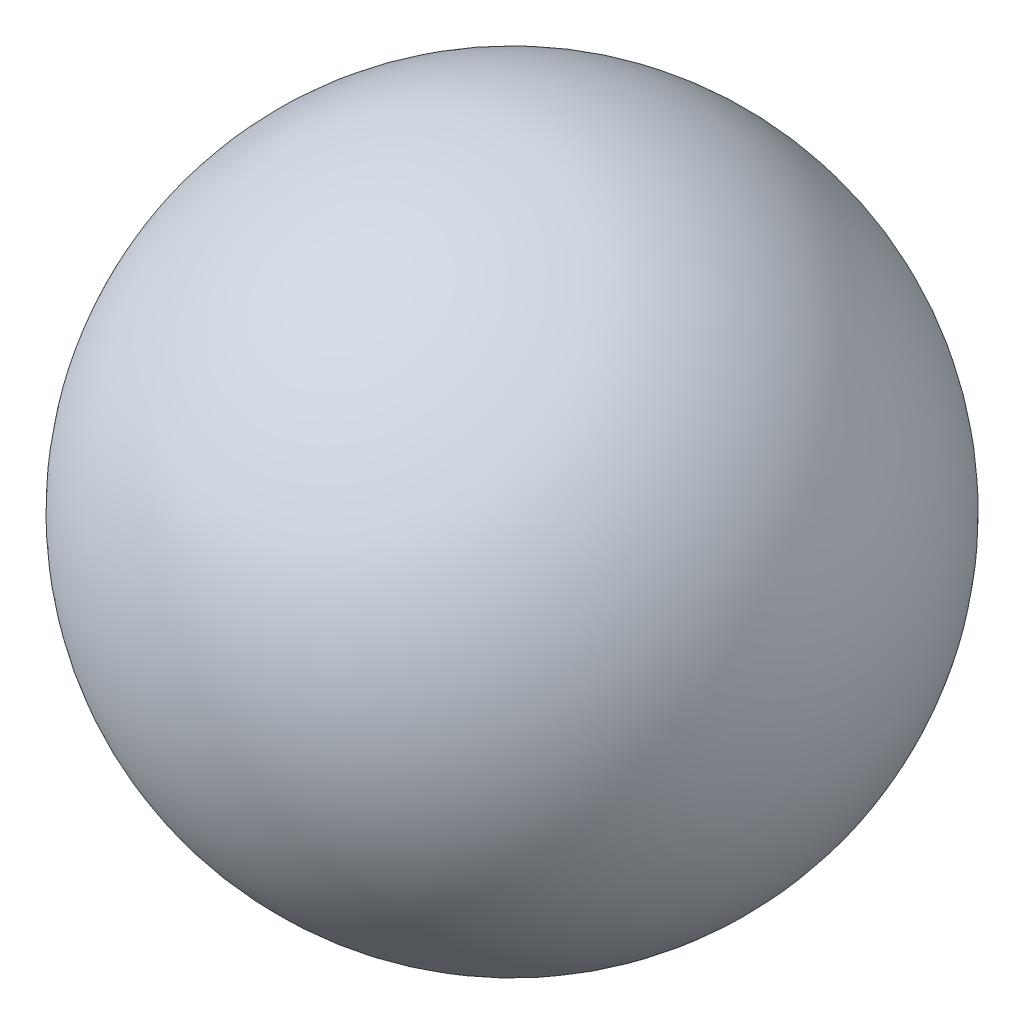
from build123d import *

# Parameters (mm, degrees)
SCALE1_SCALE = 6
SCALE2_SCALE = 3.323882225
SCALE3_SCALE = 0.416652997
SCALE4_SCALE = 0.70539227
SCALE5_SCALE = 0.666666667


with BuildPart() as part:
    # Sketch1 → Revolve1 (revolve)
    with BuildSketch(Plane.XY):
        with BuildLine():
            Line((0, 0), (2.2, 0))
            ThreePointArc((2.2, 0), (0, 2.2), (-2.2, 0))
            Line((-2.2, 0), (0, 0))
        make_face()
    revolve(axis=Axis((0, 0, 0), (-1, 0, 0)))


with BuildPart() as part_1:
    # Scale1: scaled about (0, 0, 0)
    add(part.part.scale(SCALE1_SCALE))


with BuildPart() as part_2:
    # Scale2: scaled about (0, 0, 0)
    add(part_1.part.scale(SCALE2_SCALE))


with BuildPart() as part_3:
    # Scale3: scaled about (0, 0, 0)
    add(part_2.part.scale(SCALE3_SCALE))


with BuildPart() as part_4:
    # Scale4: scaled about (0, 0, 0)
    add(part_3.part.scale(SCALE4_SCALE))


with BuildPart() as part_5:
    # Scale5: scaled about (0, 0, 0)
    add(part_4.part.scale(SCALE5_SCALE))


solid = part_5.part
